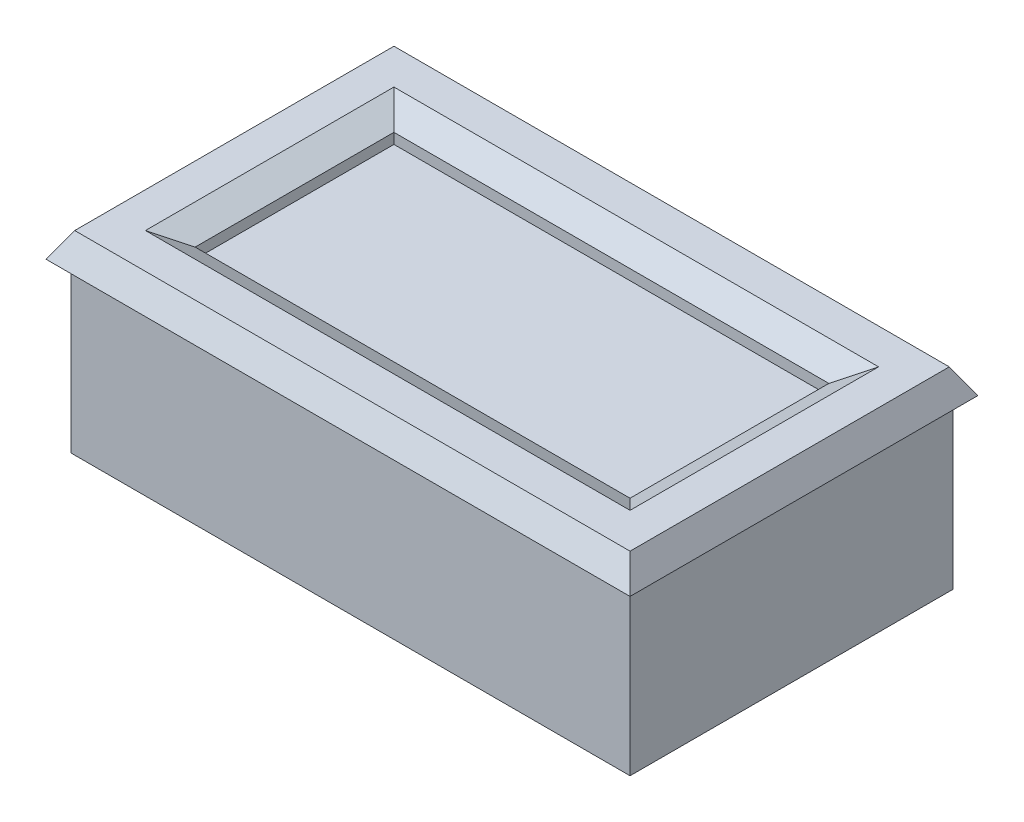
from build123d import *
from OCP.BRepFilletAPI import BRepFilletAPI_MakeChamfer

# Parameters (mm, degrees)
SKETCH1_W           = 45
SKETCH1_H           = 26
BOSS_EXTRUDE1_DEPTH = 13.5
SKETCH2_W           = 47
SKETCH2_H           = 28
SKETCH2_W_2         = 35
SKETCH2_H_2         = 16
BOSS_EXTRUDE2_DEPTH = 2
CHAMFER1_SIZE       = 2
CHAMFER1_SIZE_2     = 1.154700538
CUT_EXTRUDE1_DEPTH  = 13.5


with BuildPart() as part:
    # Sketch1 → Boss-Extrude1 (new body)
    with BuildSketch(Plane(origin=(0, 0, 0), x_dir=(1, 0, 0), z_dir=(0, 1, 0))):
        Rectangle(SKETCH1_W, SKETCH1_H)
    extrude(amount=BOSS_EXTRUDE1_DEPTH)

    # Sketch2 → Boss-Extrude2 (add)
    with BuildSketch(Plane(origin=(0, 13.5, 0), x_dir=(1, 0, 0), z_dir=(0, 1, 0))):
        Rectangle(SKETCH2_W, SKETCH2_H)
        Rectangle(SKETCH2_W_2, SKETCH2_H_2, mode=Mode.SUBTRACT)
    extrude(amount=BOSS_EXTRUDE2_DEPTH)

    # Chamfer1
    chamfer1_edges_1 = [part.edges().sort_by_distance(p)[0] for p in [
        (0, 15.5, -8),
    ]]
    chamfer1_side_1 = [part.faces().sort_by_distance(p)[0] for p in [
        (0, 15.5, -8.023094011),
    ]]
    chamfer1_edges_2 = [part.edges().sort_by_distance(p)[0] for p in [
        (-17.5, 15.5, 0),
    ]]
    chamfer1_side_2 = [part.faces().sort_by_distance(p)[0] for p in [
        (-17.523094011, 15.5, 0),
    ]]
    chamfer1_edges_3 = [part.edges().sort_by_distance(p)[0] for p in [
        (0, 15.5, 8),
    ]]
    chamfer1_side_3 = [part.faces().sort_by_distance(p)[0] for p in [
        (0, 15.5, 8.023094011),
    ]]
    chamfer1_edges_4 = [part.edges().sort_by_distance(p)[0] for p in [
        (17.5, 15.5, 0),
    ]]
    chamfer1_side_4 = [part.faces().sort_by_distance(p)[0] for p in [
        (17.523094011, 15.5, 0),
    ]]
    chamfer1_edges_5 = [part.edges().sort_by_distance(p)[0] for p in [
        (-23.5, 15.5, 0),
    ]]
    chamfer1_side_5 = [part.faces().sort_by_distance(p)[0] for p in [
        (-23.5, 15.476905989, 0),
    ]]
    chamfer1_edges_6 = [part.edges().sort_by_distance(p)[0] for p in [
        (0, 15.5, -14),
    ]]
    chamfer1_side_6 = [part.faces().sort_by_distance(p)[0] for p in [
        (0, 15.476905989, -14),
    ]]
    chamfer1_edges_7 = [part.edges().sort_by_distance(p)[0] for p in [
        (23.5, 15.5, 0),
    ]]
    chamfer1_side_7 = [part.faces().sort_by_distance(p)[0] for p in [
        (23.5, 15.476905989, 0),
    ]]
    chamfer1_edges_8 = [part.edges().sort_by_distance(p)[0] for p in [
        (0, 15.5, 14),
    ]]
    chamfer1_side_8 = [part.faces().sort_by_distance(p)[0] for p in [
        (0, 15.476905989, 14),
    ]]
    chamfer1 = BRepFilletAPI_MakeChamfer(part.part.solid().wrapped)
    for e in chamfer1_edges_1:
        chamfer1.Add(CHAMFER1_SIZE - 0.0001, CHAMFER1_SIZE_2 - 0.0001, e.wrapped, chamfer1_side_1[0].wrapped)
    for e in chamfer1_edges_2:
        chamfer1.Add(CHAMFER1_SIZE - 0.0001, CHAMFER1_SIZE_2 - 0.0001, e.wrapped, chamfer1_side_2[0].wrapped)
    for e in chamfer1_edges_3:
        chamfer1.Add(CHAMFER1_SIZE - 0.0001, CHAMFER1_SIZE_2 - 0.0001, e.wrapped, chamfer1_side_3[0].wrapped)
    for e in chamfer1_edges_4:
        chamfer1.Add(CHAMFER1_SIZE - 0.0001, CHAMFER1_SIZE_2 - 0.0001, e.wrapped, chamfer1_side_4[0].wrapped)
    for e in chamfer1_edges_5:
        chamfer1.Add(CHAMFER1_SIZE - 0.0001, CHAMFER1_SIZE_2 - 0.0001, e.wrapped, chamfer1_side_5[0].wrapped)
    for e in chamfer1_edges_6:
        chamfer1.Add(CHAMFER1_SIZE - 0.0001, CHAMFER1_SIZE_2 - 0.0001, e.wrapped, chamfer1_side_6[0].wrapped)
    for e in chamfer1_edges_7:
        chamfer1.Add(CHAMFER1_SIZE - 0.0001, CHAMFER1_SIZE_2 - 0.0001, e.wrapped, chamfer1_side_7[0].wrapped)
    for e in chamfer1_edges_8:
        chamfer1.Add(CHAMFER1_SIZE - 0.0001, CHAMFER1_SIZE_2 - 0.0001, e.wrapped, chamfer1_side_8[0].wrapped)
    add(Compound.cast(chamfer1.Shape()), mode=Mode.REPLACE)  # a hair under: the kernel refuses the full size

    # Sketch3 → Cut-Extrude1 (cut)
    with BuildSketch(Plane.XZ):
        with BuildLine():
            Line((-22, -4), (-19.5, -4))
            ThreePointArc((-19.5, -4), (-18, -5.5), (-19.5, -7))
            Line((-19.5, -7), (-22, -7))
            Line((-22, -7), (-22, -4))
        make_face()
    extrude(amount=-CUT_EXTRUDE1_DEPTH, mode=Mode.SUBTRACT)


solid = part.part
